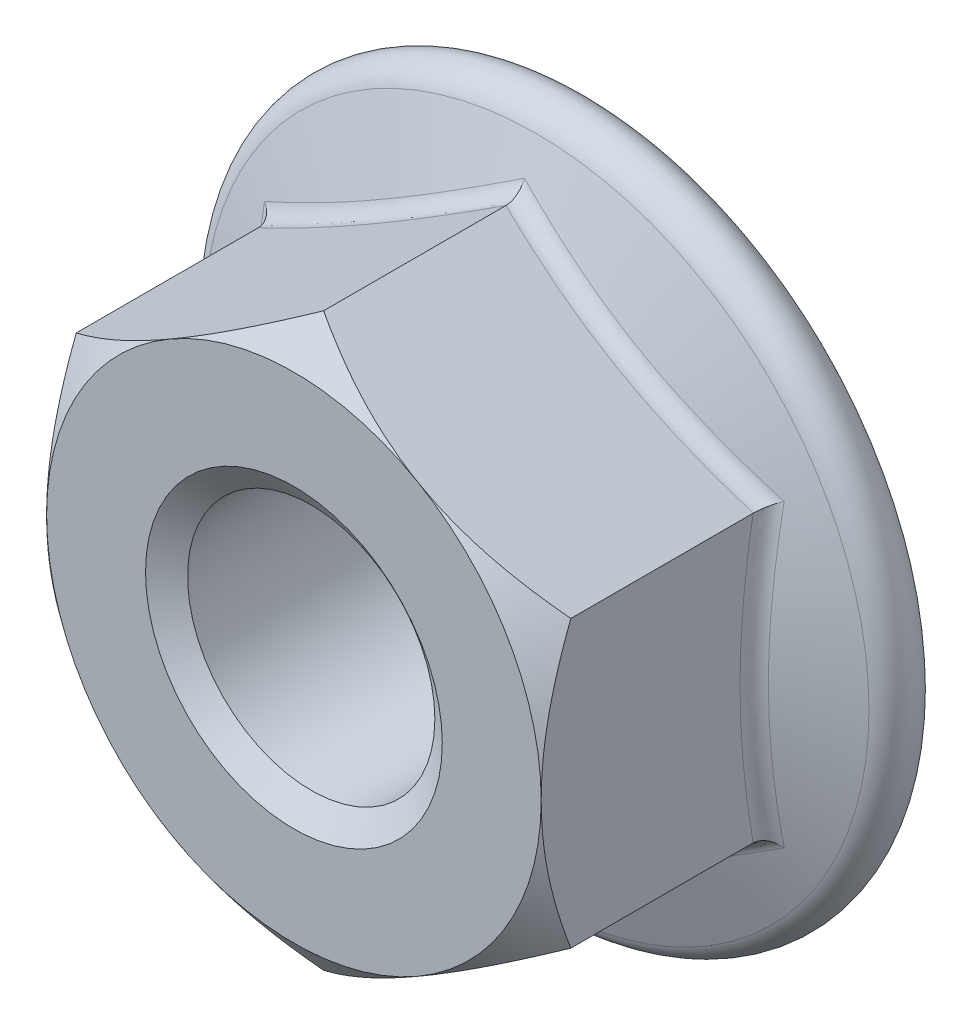
from build123d import *

# Parameters (mm, degrees)
BASENUT_START  = -6
BASENUTSKE_R   = 2.5
BASENUT_DEPTH  = 6
FLANGEFILLET_R = 0.36


# Read off the part's stored shape, not the designer's step: ThdSchPat
with BuildPart() as part:
    # BaseNutSke → BaseNut (new body)
    with BuildSketch(Plane.XY.offset(BASENUT_START)):
        Polygon((5, 2.886751346), (5, -2.886751346), (0, -5.773502692), (-5, -2.886751346), (-5, 2.886751346), (0, 5.773502692), align=None)
        Circle(BASENUTSKE_R, mode=Mode.SUBTRACT)
    extrude(amount=BASENUT_DEPTH)

    # Sketch5 (on Right Plane) → EndChamfer (revolve, cut)
    with BuildSketch(Plane(origin=(0, 0, 0), x_dir=(0, 0, -1), z_dir=(1, 0, 0))):
        Polygon((5.9746, 3), (5.589485854, 2.45), (6.0254, 2.45), (6.0254, 3), align=None)
    revolve(axis=Axis((0, 2.45, -6.0254), (0, 0, 1)), mode=Mode.SUBTRACT)

    # Sketch6 → Flange (revolve)
    with BuildSketch(Plane(origin=(0, 0, 0), x_dir=(0, 0, -1), z_dir=(1, 0, 0)), mode=Mode.PRIVATE) as flange_sk:
        with BuildLine():
            Line((3.361548952, 2.5), (4.9, 6.726859517))
            ThreePointArc((4.9, 6.726859517), (5.531375747, 7.091384474), (6, 6.532899838))
            Line((6, 6.532899838), (6, 2.5))
            Line((6, 2.5), (3.361548952, 2.5))
        make_face()
    revolve(flange_sk.sketch.rotate(Axis((0, 0, 0), (0, 0, -1)), 90), axis=Axis((0, 0, 0), (0, 0, -1)))

    # Sketch3 → Double-Chamfer (revolve, cut)
    with BuildSketch(Plane(origin=(0, 0, 0), x_dir=(0, 0, -1), z_dir=(1, 0, 0)), mode=Mode.PRIVATE) as double_chamfer_sk:
        Polygon((0.6, 18.473502692), (-12.7, 18.473502692), (-12.7, 5), (0, 5), (0.6, 5.773502692), align=None)
    revolve(double_chamfer_sk.sketch.rotate(Axis((0, 0, 0), (0, 0, -1)), 90), axis=Axis((0, 0, 0), (0, 0, -1)), mode=Mode.SUBTRACT)

    # FlangeFillet
    flangefillet_edges = [part.edges().sort_by_distance(p)[0] for p in [
        (5, 1.449672147, -4.34642141),
        (2.5, 4.330127019, -4.271474537),
        (-2.5, 4.330127019, -4.271474537),
        (-5, 0, -4.271474537),
        (-2.5, -4.330127019, -4.271474537),
        (2.5, -4.330127019, -4.271474537),
        (5, -1.449672147, -4.34642141),
    ]]
    fillet(flangefillet_edges, radius=FLANGEFILLET_R)

    # ThreadSchematic outline → ThreadSchematic (revolve, cut)
    with BuildSketch(Plane.XZ):
        Polygon((2.5, 0), (2.5, -0.350103769), (3, 0), align=None)
        Polygon((3, -5.9746), (2.5, -5.624496231), (2.5, -6), (3, -6), align=None)
    revolve(axis=Axis((0, 0, 0), (0, 0, 1)), mode=Mode.SUBTRACT)


solid = part.part
